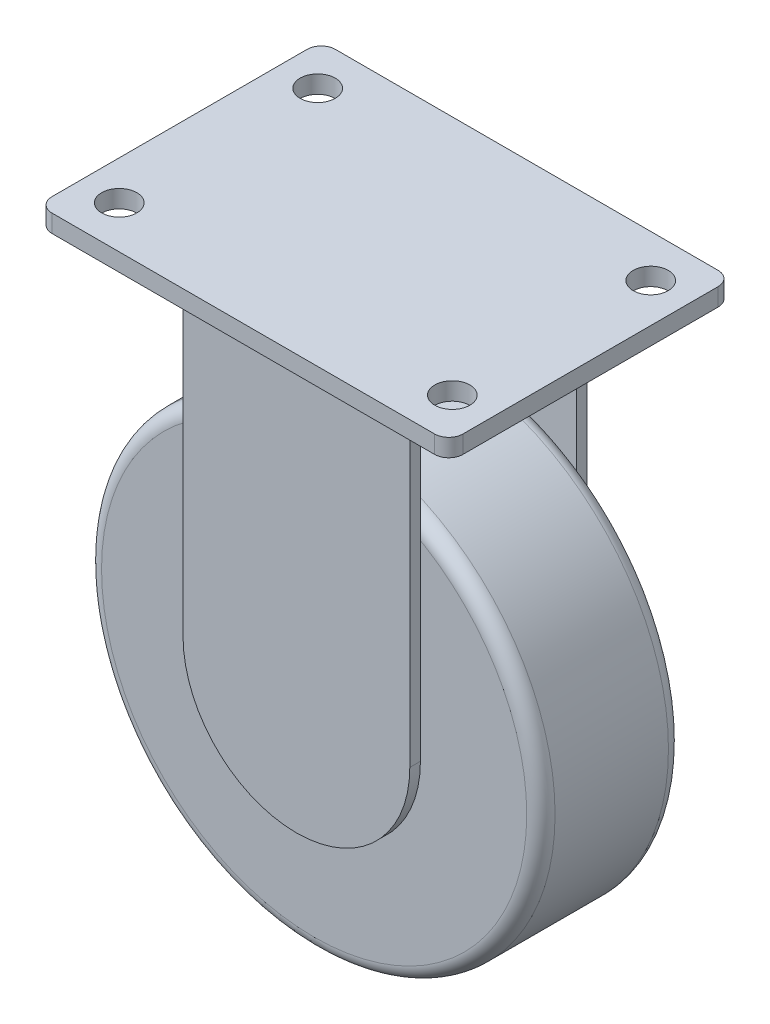
from build123d import *

# Parameters (mm, degrees)
SKETCH1_W                  = 92.075
SKETCH1_H                  = 63.5
SKETCH1_R                  = 3.937
EXTRUDE1_DEPTH             = 3.96875
SKETCH2_W                  = 50.8
SKETCH2_H                  = 2.38125
EXTRUDE2_DEPTH             = 100.80625
FILLET1_R                  = 25.4
EXTRUDE3_REACH             = 117.28
SKETCH3_R                  = 6.35
EXTRUDE3_DIRECTION_2_REACH = 117.28
SKETCH4_R                  = 50.8
EXTRUDE4_DEPTH             = 15.875
FILLET2_R                  = 3.175
FILLET3_R                  = 3.175


with BuildPart() as part:
    # Sketch1 → Extrude1 (new body)
    with BuildSketch(Plane(origin=(0, 0, 0), x_dir=(1, 0, 0), z_dir=(0, 1, 0))):
        Rectangle(SKETCH1_W, SKETCH1_H)
        with Locations(Location((-37.30625, 22.225, 0), (0, 0, 270))):
            Circle(SKETCH1_R, mode=Mode.SUBTRACT)
        with Locations(Location((-37.30625, -22.225, 0), (0, 0, 270))):
            Circle(SKETCH1_R, mode=Mode.SUBTRACT)
        with Locations(Location((37.30625, -22.225, 0), (0, 0, 270))):
            Circle(SKETCH1_R, mode=Mode.SUBTRACT)
        with Locations(Location((37.30625, 22.225, 0), (0, 0, 270))):
            Circle(SKETCH1_R, mode=Mode.SUBTRACT)
    extrude(amount=EXTRUDE1_DEPTH)

    # Sketch2 → Extrude2 (add)
    with BuildSketch(Plane(origin=(0, 0, 0), x_dir=(-1, 0, 0), z_dir=(0, 1, 0))):
        with Locations((0, 18.653125)):
            Rectangle(SKETCH2_W, SKETCH2_H)
        with Locations((0, -18.653125)):
            Rectangle(SKETCH2_W, SKETCH2_H)
    extrude(amount=-EXTRUDE2_DEPTH)

    # Fillet1
    fillet1_edges = [part.edges().sort_by_distance(p)[0] for p in [
        (-25.4, -100.80625, 18.653125),
        (-25.4, -100.80625, -18.653125),
        (25.4, -100.80625, -18.653125),
        (25.4, -100.80625, 18.653125),
    ]]
    fillet(fillet1_edges, radius=FILLET1_R - 0.0001)  # a hair under: the kernel refuses the full size

    # Sketch3 → Extrude3 (add, up to next)
    with BuildSketch(Plane.XY, mode=Mode.PRIVATE) as extrude3_sk1:
        with Locations((0, -75.40625)):
            Circle(SKETCH3_R)
    extrude3_tool1 = extrude(extrude3_sk1.sketch, amount=EXTRUDE3_REACH, mode=Mode.PRIVATE) - part.part
    add(extrude3_tool1.solids().sort_by_distance((0, -75.40625, 0))[0])

    # Sketch3 → Extrude3 direction 2 (add, up to next)
    with BuildSketch(Plane.XY, mode=Mode.PRIVATE) as extrude3_direction_2_sk1:
        with Locations((0, -75.40625)):
            Circle(SKETCH3_R)
    extrude3_direction_2_tool1 = extrude(extrude3_direction_2_sk1.sketch, amount=-EXTRUDE3_DIRECTION_2_REACH, mode=Mode.PRIVATE) - part.part
    add(extrude3_direction_2_tool1.solids().sort_by_distance((0, -75.40625, 0))[0])

    # Sketch4 → Extrude4 (add, symmetric)
    with BuildSketch(Plane.XY):
        with Locations((0, -75.40625)):
            Circle(SKETCH4_R)
    extrude(amount=EXTRUDE4_DEPTH, both=True)

    # Fillet2
    fillet2_edges = [part.edges().sort_by_distance(p)[0] for p in [
        (-50.8, -75.40625, -15.875),
        (-50.8, -75.40625, 15.875),
    ]]
    fillet(fillet2_edges, radius=FILLET2_R)

    # Fillet3
    fillet3_edges = [part.edges().sort_by_distance(p)[0] for p in [
        (-46.0375, 1.984375, -31.75),
        (46.0375, 1.984375, -31.75),
        (46.0375, 1.984375, 31.75),
        (-46.0375, 1.984375, 31.75),
    ]]
    fillet(fillet3_edges, radius=FILLET3_R)


solid = part.part
